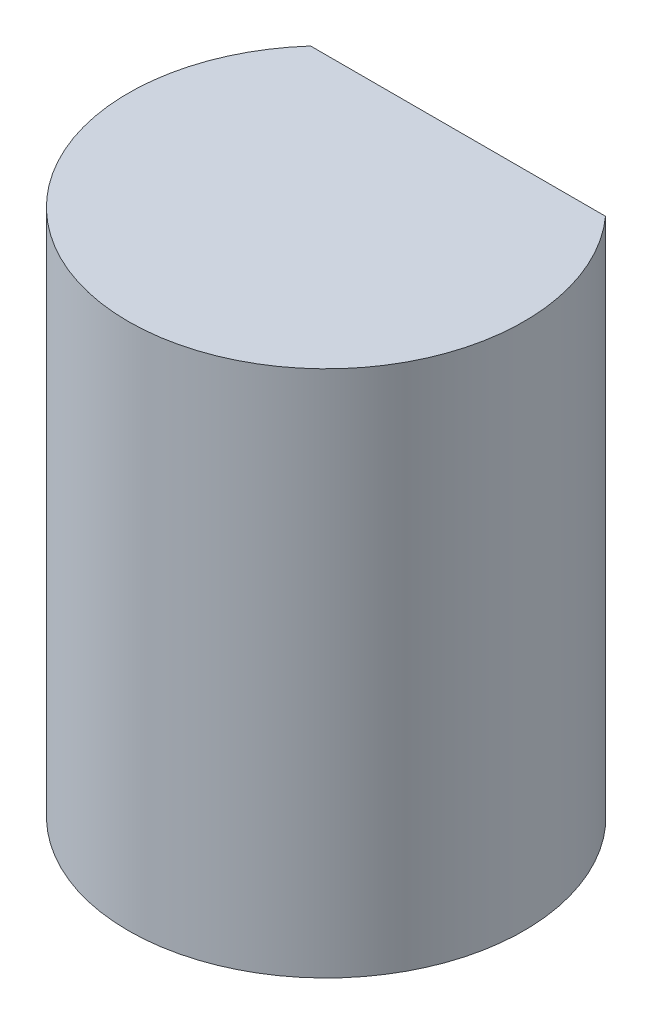
from build123d import *

# Parameters (mm, degrees)
SKETCH1_R           = 1.5
BOSS_EXTRUDE1_DEPTH = 4
CUT_EXTRUDE1_REACH  = 6.528
SKETCH6_W           = 2.236067978
SKETCH6_H           = 0.5


with BuildPart() as part:
    # Sketch1 → Boss-Extrude1 (new body)
    with BuildSketch(Plane(origin=(0, 0, 0), x_dir=(1, 0, 0), z_dir=(0, 1, 0))):
        Circle(SKETCH1_R)
    extrude(amount=BOSS_EXTRUDE1_DEPTH)

    # Sketch6 → Cut-Extrude1 (cut, up to next)
    with BuildSketch(Plane(origin=(0, 4, 0), x_dir=(1, 0, 0), z_dir=(0, 1, 0)), mode=Mode.PRIVATE) as cut_extrude1_sk1:
        with Locations((0, 1.25)):
            Rectangle(SKETCH6_W, SKETCH6_H)
    cut_extrude1_tool1 = extrude(cut_extrude1_sk1.sketch, amount=-CUT_EXTRUDE1_REACH, mode=Mode.PRIVATE) & part.part
    add(cut_extrude1_tool1.solids().sort_by_distance((0, 4, -1.25))[0], mode=Mode.SUBTRACT)


solid = part.part
